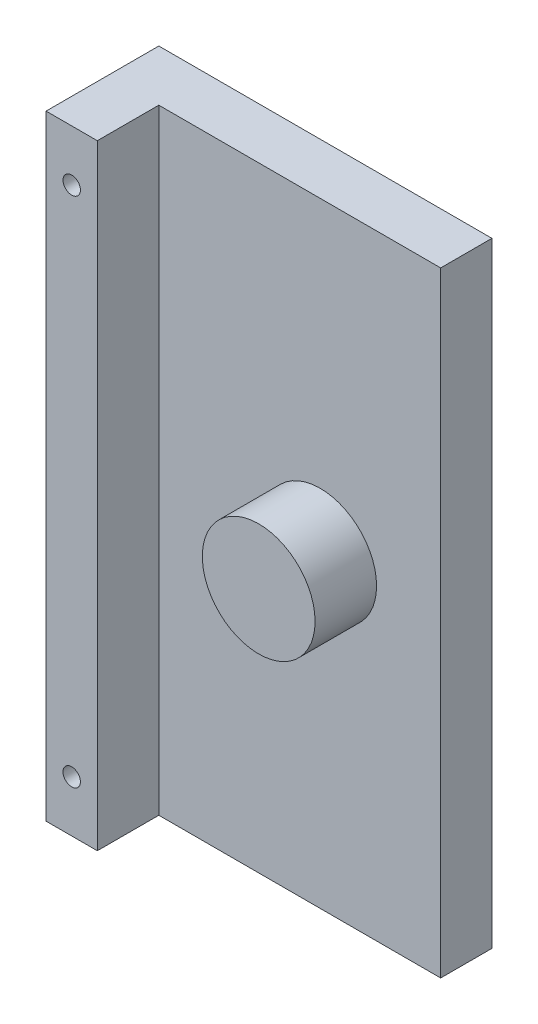
from build123d import *

# Parameters (mm, degrees)
SKETCH1_W           = 120
SKETCH1_H           = 65
BOSS_EXTRUDE1_DEPTH = 10
SKETCH2_W           = 10
SKETCH2_H           = 120
BOSS_EXTRUDE2_DEPTH = 12
SKETCH3_R           = 11
BOSS_EXTRUDE3_DEPTH = 12
SKETCH4_R           = 1.7
CUT_EXTRUDE1_DEPTH  = 22


with BuildPart() as part:
    # Sketch1 → Boss-Extrude1 (new body)
    with BuildSketch(Plane(origin=(0, 0, 0), x_dir=(0, 1, 0), z_dir=(0, 0, 1))):
        Rectangle(SKETCH1_W, SKETCH1_H)
    extrude(amount=BOSS_EXTRUDE1_DEPTH)

    # Sketch2 → Boss-Extrude2 (add)
    with BuildSketch(Plane.XY.offset(10)):
        with Locations((-27.5, 0)):
            Rectangle(SKETCH2_W, SKETCH2_H)
    extrude(amount=BOSS_EXTRUDE2_DEPTH)

    # Sketch3 → Boss-Extrude3 (add)
    with BuildSketch(Plane.XY.offset(10)):
        with Locations((8.99, 0)):
            Circle(SKETCH3_R)
    extrude(amount=BOSS_EXTRUDE3_DEPTH)

    # Sketch4 → Cut-Extrude1 (cut)
    with BuildSketch(Plane.XY.offset(22)):
        with Locations((-27.5, 50)):
            Circle(SKETCH4_R)
        with Locations((-27.5, -50)):
            Circle(SKETCH4_R)
    extrude(amount=-CUT_EXTRUDE1_DEPTH, mode=Mode.SUBTRACT)


solid = part.part
